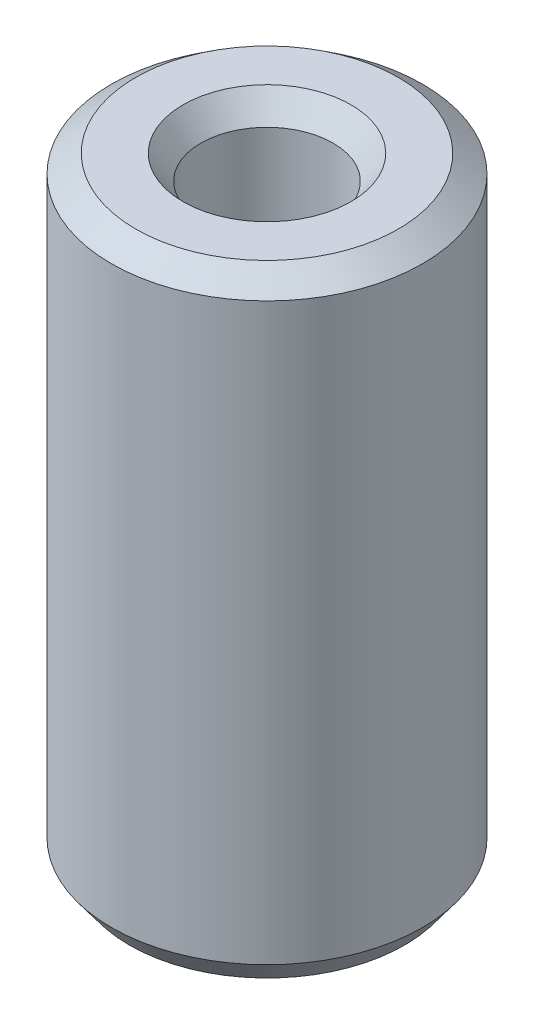
from build123d import *
from OCP.BRepFilletAPI import BRepFilletAPI_MakeChamfer

# Parameters (mm, degrees)
SKETCH1_R           = 7.5
BOSS_EXTRUDE1_DEPTH = 29.74446061
SKETCH2_R           = 3.184438572
CUT_EXTRUDE1_DEPTH  = 32.578995186
CHAMFER1_SIZE       = 0.864206618
CHAMFER1_SIZE2      = 1.167448415


with BuildPart() as part:
    # Sketch1 → Boss-Extrude1 (new body)
    with BuildSketch(Plane(origin=(0, 0, 0), x_dir=(1, 0, 0), z_dir=(0, 1, 0))):
        Circle(SKETCH1_R)
    extrude(amount=BOSS_EXTRUDE1_DEPTH)

    # Sketch2 → Cut-Extrude1 (cut, through all)
    with BuildSketch(Plane(origin=(0, 0, 0), x_dir=(1, 0, 0), z_dir=(0, 1, 0))):
        Circle(SKETCH2_R)
    extrude(amount=CUT_EXTRUDE1_DEPTH, mode=Mode.SUBTRACT)

    # Chamfer1: one chamfer whose edges measure the first distance from different faces: ONE call of the kernel's chamfer builder (chamfer() names one face for all edges)
    chamfer1_edges_1 = [part.edges().sort_by_distance(p)[0] for p in [
        (-3.184438572, 29.74446061, 0),
    ]]
    chamfer1_side_1 = [part.faces().sort_by_distance(p)[0] for p in [
        (-7.287867966, 29.74446061, 0),
    ]]
    chamfer1_edges_2 = [part.edges().sort_by_distance(p)[0] for p in [
        (-3.184438572, 0, 0),
    ]]
    chamfer1_side_2 = [part.faces().sort_by_distance(p)[0] for p in [
        (-3.184438572, 14.872230305, 0),
    ]]
    chamfer1_edges_3 = [part.edges().sort_by_distance(p)[0] for p in [
        (-7.5, 0, 0),
    ]]
    chamfer1_side_3 = [part.faces().sort_by_distance(p)[0] for p in [
        (-7.287867966, 0, 0),
    ]]
    chamfer1_edges_4 = [part.edges().sort_by_distance(p)[0] for p in [
        (-7.5, 29.74446061, 0),
    ]]
    chamfer1_side_4 = [part.faces().sort_by_distance(p)[0] for p in [
        (-7.5, 14.872230305, 0),
    ]]
    chamfer1 = BRepFilletAPI_MakeChamfer(part.part.solid().wrapped)
    for e in chamfer1_edges_1:
        chamfer1.Add(CHAMFER1_SIZE, CHAMFER1_SIZE2, e.wrapped, chamfer1_side_1[0].wrapped)  # the first distance lies on this face
    for e in chamfer1_edges_2:
        chamfer1.Add(CHAMFER1_SIZE, CHAMFER1_SIZE2, e.wrapped, chamfer1_side_2[0].wrapped)  # the first distance lies on this face
    for e in chamfer1_edges_3:
        chamfer1.Add(CHAMFER1_SIZE, CHAMFER1_SIZE2, e.wrapped, chamfer1_side_3[0].wrapped)  # the first distance lies on this face
    for e in chamfer1_edges_4:
        chamfer1.Add(CHAMFER1_SIZE, CHAMFER1_SIZE2, e.wrapped, chamfer1_side_4[0].wrapped)  # the first distance lies on this face
    add(Compound.cast(chamfer1.Shape()), mode=Mode.REPLACE)


solid = part.part
